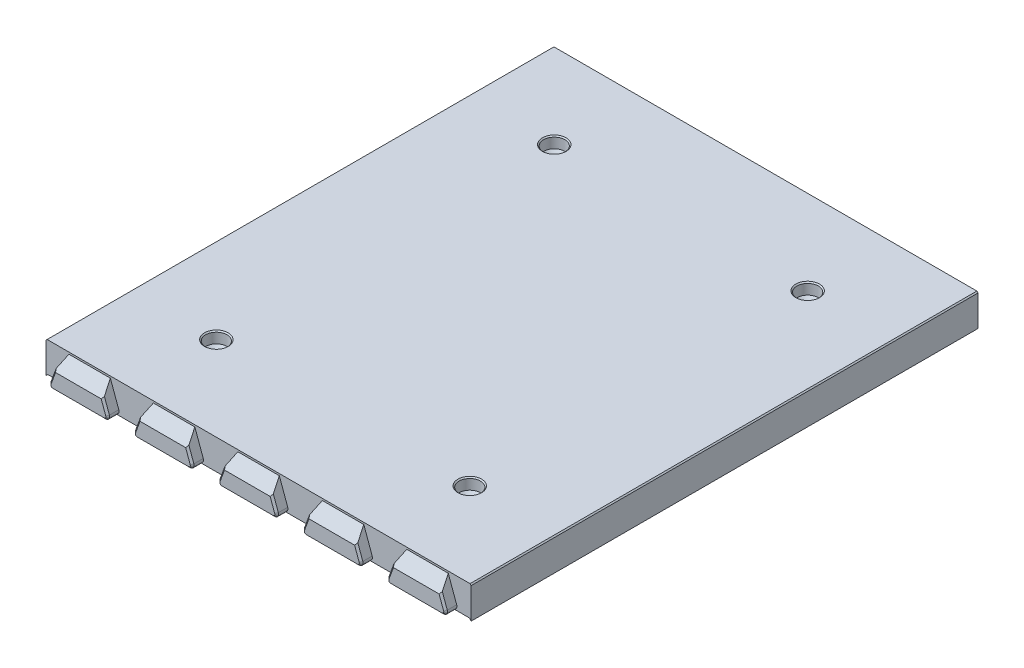
from build123d import *

# Parameters (mm, degrees)
BOSS_EXTRUDE1_DEPTH             = 67.5
SKETCH7_W                       = 109.25
SKETCH7_H                       = 6
BOSS_EXTRUDE7_DEPTH             = 1
BOSS_EXTRUDE4_DEPTH             = 3
BOSS_EXTRUDE8_REACH             = 90.468
BOSS_EXTRUDE8_DIRECTION_2_DEPTH = 2
CHAMFER4_SIZE                   = 0.5
FILLET4_R                       = 1
CHAMFER6_SIZE                   = 0.5
FILLET2_R                       = 2
CHAMFER4_OF_MIRROR2_SIZE        = 0.5
FILLET4_OF_MIRROR2_R            = 1
CHAMFER6_OF_MIRROR2_SIZE        = 0.5
FILLET2_OF_MIRROR2_R            = 2
BOSS_EXTRUDE9_REACH             = 151.38
SKETCH9_R                       = 5
FILLET3_R                       = 3
SKETCH10_R                      = 1.85
CUT_EXTRUDE2_DEPTH              = 150.380020836
SKETCH11_R                      = 2.85
CUT_EXTRUDE3_DEPTH              = 3
CHAMFER7_SIZE                   = 1
CUT_EXTRUDE4_DEPTH              = 150.380020836
CUT_EXTRUDE4_DEPTH_BACK         = 150.380020836
BOSS_EXTRUDE10_DEPTH            = 135
CHAMFER8_SIZE                   = 0.3


with BuildPart() as part:
    # Sketch1 → Boss-Extrude1 (new body)
    with BuildSketch(Plane.XY):
        Polygon((-56.625, 0), (-56.625, 8), (56.625, 8), (56.625, 0), (54.625, 0), (54.625, 6), (-54.625, 6), (-54.625, 0), align=None)
    boss_extrude1 = extrude(amount=-BOSS_EXTRUDE1_DEPTH)

    # Sketch7 → Boss-Extrude7 (add)
    with BuildSketch(Plane.XY):
        with Locations((0, 3)):
            Rectangle(SKETCH7_W, SKETCH7_H)
    boss_extrude7 = extrude(amount=-BOSS_EXTRUDE7_DEPTH)

    # Sketch2 → Boss-Extrude4 (add)
    with BuildSketch(Plane.XY):
        Polygon((39.661761874, 8), (36.75, 0), (53.25, 0), (50.338238126, 8), align=None)
        Polygon((17.161761874, 8), (14.25, 0), (30.75, 0), (27.838238126, 8), align=None)
        Polygon((-5.338238126, 8), (-8.25, 0), (8.25, 0), (5.338238126, 8), align=None)
        Polygon((-27.838238126, 8), (-30.75, 0), (-14.25, 0), (-17.161761874, 8), align=None)
        Polygon((-50.338238126, 8), (-53.25, 0), (-36.75, 0), (-39.661761874, 8), align=None)
    boss_extrude4 = extrude(amount=BOSS_EXTRUDE4_DEPTH)

    # Sketch8 → Boss-Extrude8 (add, up to next)
    with BuildSketch(Plane.XZ, mode=Mode.PRIVATE) as boss_extrude8_sk1:
        Polygon((-55.25, -24.955880937), (-55.25, -20.044119063), (-51.25, -21.5), (-51.25, -23.5), align=None)
    boss_extrude8_tool1 = extrude(boss_extrude8_sk1.sketch, amount=-BOSS_EXTRUDE8_REACH, mode=Mode.PRIVATE) - part.part
    # Sketch8 → Boss-Extrude8 (add, up to next)
    with BuildSketch(Plane.XZ, mode=Mode.PRIVATE) as boss_extrude8_sk2:
        Polygon((-55.25, -67.5), (-55.25, -65.044119063), (-51.25, -66.5), (-51.25, -67.5), align=None)
    boss_extrude8_tool2 = extrude(boss_extrude8_sk2.sketch, amount=-BOSS_EXTRUDE8_REACH, mode=Mode.PRIVATE) - part.part
    # Sketch8 → Boss-Extrude8 (add, up to next)
    with BuildSketch(Plane.XZ, mode=Mode.PRIVATE) as boss_extrude8_sk3:
        Polygon((55.25, -24.955880937), (51.25, -23.5), (51.25, -21.5), (55.25, -20.044119063), align=None)
    boss_extrude8_tool3 = extrude(boss_extrude8_sk3.sketch, amount=-BOSS_EXTRUDE8_REACH, mode=Mode.PRIVATE) - part.part
    # Sketch8 → Boss-Extrude8 (add, up to next)
    with BuildSketch(Plane.XZ, mode=Mode.PRIVATE) as boss_extrude8_sk4:
        Polygon((51.25, -67.5), (55.25, -67.5), (55.25, -65.044119063), (51.25, -66.5), align=None)
    boss_extrude8_tool4 = extrude(boss_extrude8_sk4.sketch, amount=-BOSS_EXTRUDE8_REACH, mode=Mode.PRIVATE) - part.part
    boss_extrude8_1 = boss_extrude8_tool1.solids().sort_by_distance((-53.530851, 0, -22.5))[0]
    add(boss_extrude8_1)
    boss_extrude8_2 = boss_extrude8_tool2.solids().sort_by_distance((-53.530851, 0, -66.584919))[0]
    add(boss_extrude8_2)
    boss_extrude8_3 = boss_extrude8_tool3.solids().sort_by_distance((53.530851, 0, -22.5))[0]
    add(boss_extrude8_3)
    boss_extrude8_4 = boss_extrude8_tool4.solids().sort_by_distance((53.530851, 0, -66.584919))[0]
    add(boss_extrude8_4)
    boss_extrude8 = boss_extrude8_1 + boss_extrude8_2 + boss_extrude8_3 + boss_extrude8_4  # Boss-Extrude8 as one shape, for the pattern or mirror that repeats it

    # Sketch8 → Boss-Extrude8 direction 2 (add)
    with BuildSketch(Plane.XZ):
        Polygon((-55.25, -24.955880937), (-55.25, -20.044119063), (-51.25, -21.5), (-51.25, -23.5), align=None)
        Polygon((-55.25, -67.5), (-55.25, -65.044119063), (-51.25, -66.5), (-51.25, -67.5), align=None)
        Polygon((55.25, -24.955880937), (51.25, -23.5), (51.25, -21.5), (55.25, -20.044119063), align=None)
        Polygon((51.25, -67.5), (55.25, -67.5), (55.25, -65.044119063), (51.25, -66.5), align=None)
    boss_extrude8_direction_2 = extrude(amount=BOSS_EXTRUDE8_DIRECTION_2_DEPTH)

    # Chamfer4
    chamfer4_edges = [part.edges().sort_by_distance(p)[0] for p in [
        (-51.25, -2, -67),
        (-53.25, -2, -65.772059531),
        (-55.25, -2, -66.272059531),
        (-53.25, -2, -20.772059531),
        (-55.25, -2, -22.5),
        (-53.25, -2, -24.227940469),
        (-51.25, -2, -22.5),
        (55.25, -2, -22.5),
        (53.25, -2, -20.772059531),
        (51.25, -2, -22.5),
        (53.25, -2, -24.227940469),
        (51.25, -2, -67),
        (55.25, -2, -66.272059531),
        (53.25, -2, -65.772059531),
    ]]
    chamfer(chamfer4_edges, length=CHAMFER4_SIZE)

    # Fillet4
    fillet4_edges = [part.edges().sort_by_distance(p)[0] for p in [
        (36.75, 0, 1.5),
        (53.25, 0, 1.5),
        (14.25, 0, 1.5),
        (30.75, 0, 1.5),
        (-8.25, 0, 1.5),
        (8.25, 0, 1.5),
        (-53.25, 0, 1.5),
        (-36.75, 0, 1.5),
        (-30.75, 0, 1.5),
        (-14.25, 0, 1.5),
    ]]
    fillet(fillet4_edges, radius=FILLET4_R)

    # Chamfer6
    chamfer6_edges = [part.edges().sort_by_distance(p)[0] for p in [
        (51.54989137, 4.671010072, 3),
        (45, 0, 3),
        (22.5, 0, 3),
        (0, 0, 3),
        (-22.5, 0, 3),
        (-45, 0, 3),
        (37.358995962, 0.426423564, 3),
        (52.641004038, 0.426423564, 3),
        (29.04989137, 4.671010072, 3),
        (14.858995962, 0.426423564, 3),
        (30.141004038, 0.426423564, 3),
        (6.54989137, 4.671010072, 3),
        (-7.641004038, 0.426423564, 3),
        (7.641004038, 0.426423564, 3),
        (-15.95010863, 4.671010072, 3),
        (-30.141004038, 0.426423564, 3),
        (-14.858995962, 0.426423564, 3),
        (-38.45010863, 4.671010072, 3),
        (-52.641004038, 0.426423564, 3),
        (-37.358995962, 0.426423564, 3),
        (38.45010863, 4.671010072, 3),
        (15.95010863, 4.671010072, 3),
        (-6.54989137, 4.671010072, 3),
        (-51.54989137, 4.671010072, 3),
        (-29.04989137, 4.671010072, 3),
    ]]
    chamfer(chamfer6_edges, length=CHAMFER6_SIZE)

    # Fillet2
    fillet2_edges = [part.edges().sort_by_distance(p)[0] for p in [
        (-54.625, 6, -45),
        (-54.625, 3, -65.271600459),
        (-51.25, 6, -67),
        (-52.9375, 6, -65.88580023),
        (-54.625, 6, -10.63580023),
        (-54.625, 3, -20.271600459),
        (-54.625, 3, -24.728399541),
        (-52.9375, 6, -20.88580023),
        (-51.25, 6, -22.5),
        (-52.9375, 6, -24.11419977),
        (54.625, 6, -10.63580023),
        (54.625, 3, -20.271600459),
        (54.625, 3, -24.728399541),
        (52.9375, 6, -20.88580023),
        (52.9375, 6, -24.11419977),
        (51.25, 6, -22.5),
        (54.625, 6, -45),
        (54.625, 3, -65.271600459),
        (51.25, 6, -67),
        (52.9375, 6, -65.88580023),
        (-54.625, 3, -1),
        (0, 6, -1),
        (54.625, 3, -1),
    ]]
    fillet(fillet2_edges, radius=FILLET2_R)


with BuildPart() as mirror2_1:
    # Mirror2: Boss-Extrude1, Boss-Extrude7, Boss-Extrude4, Boss-Extrude8, Boss-Extrude8 direction 2 across plane
    add(boss_extrude1.mirror(Plane.XY.offset(-67.5)))
    add(boss_extrude7.mirror(Plane.XY.offset(-67.5)))
    add(boss_extrude4.mirror(Plane.XY.offset(-67.5)))
    add(boss_extrude8.mirror(Plane.XY.offset(-67.5)))
    add(boss_extrude8_direction_2.mirror(Plane.XY.offset(-67.5)))

    # Chamfer4 of Mirror2
    chamfer4_of_mirror2_edges = [mirror2_1.edges().sort_by_distance(p)[0] for p in [
        (-51.25, -2, -68),
        (-53.25, -2, -69.227940469),
        (-55.25, -2, -68.727940469),
        (-53.25, -2, -114.227940469),
        (-55.25, -2, -112.5),
        (-53.25, -2, -110.772059531),
        (-51.25, -2, -112.5),
        (55.25, -2, -112.5),
        (53.25, -2, -114.227940469),
        (51.25, -2, -112.5),
        (53.25, -2, -110.772059531),
        (51.25, -2, -68),
        (55.25, -2, -68.727940469),
        (53.25, -2, -69.227940469),
    ]]
    chamfer(chamfer4_of_mirror2_edges, length=CHAMFER4_OF_MIRROR2_SIZE)

    # Fillet4 of Mirror2
    fillet4_of_mirror2_edges = [mirror2_1.edges().sort_by_distance(p)[0] for p in [
        (36.75, 0, -136.5),
        (53.25, 0, -136.5),
        (14.25, 0, -136.5),
        (30.75, 0, -136.5),
        (-8.25, 0, -136.5),
        (8.25, 0, -136.5),
        (-53.25, 0, -136.5),
        (-36.75, 0, -136.5),
        (-30.75, 0, -136.5),
        (-14.25, 0, -136.5),
    ]]
    fillet(fillet4_of_mirror2_edges, radius=FILLET4_OF_MIRROR2_R)

    # Chamfer6 of Mirror2
    chamfer6_of_mirror2_edges = [mirror2_1.edges().sort_by_distance(p)[0] for p in [
        (51.54989137, 4.671010072, -138),
        (45, 0, -138),
        (22.5, 0, -138),
        (0, 0, -138),
        (-22.5, 0, -138),
        (-45, 0, -138),
        (37.358995962, 0.426423564, -138),
        (52.641004038, 0.426423564, -138),
        (29.04989137, 4.671010072, -138),
        (14.858995962, 0.426423564, -138),
        (30.141004038, 0.426423564, -138),
        (6.54989137, 4.671010072, -138),
        (-7.641004038, 0.426423564, -138),
        (7.641004038, 0.426423564, -138),
        (-15.95010863, 4.671010072, -138),
        (-30.141004038, 0.426423564, -138),
        (-14.858995962, 0.426423564, -138),
        (-38.45010863, 4.671010072, -138),
        (-52.641004038, 0.426423564, -138),
        (-37.358995962, 0.426423564, -138),
        (38.45010863, 4.671010072, -138),
        (15.95010863, 4.671010072, -138),
        (-6.54989137, 4.671010072, -138),
        (-51.54989137, 4.671010072, -138),
        (-29.04989137, 4.671010072, -138),
    ]]
    chamfer(chamfer6_of_mirror2_edges, length=CHAMFER6_OF_MIRROR2_SIZE)

    # Fillet2 of Mirror2
    fillet2_of_mirror2_edges = [mirror2_1.edges().sort_by_distance(p)[0] for p in [
        (-54.625, 6, -90),
        (-54.625, 3, -69.728399541),
        (-51.25, 6, -68),
        (-52.9375, 6, -69.11419977),
        (-54.625, 6, -124.36419977),
        (-54.625, 3, -114.728399541),
        (-54.625, 3, -110.271600459),
        (-52.9375, 6, -114.11419977),
        (-51.25, 6, -112.5),
        (-52.9375, 6, -110.88580023),
        (54.625, 6, -124.36419977),
        (54.625, 3, -114.728399541),
        (54.625, 3, -110.271600459),
        (52.9375, 6, -114.11419977),
        (52.9375, 6, -110.88580023),
        (51.25, 6, -112.5),
        (54.625, 6, -90),
        (54.625, 3, -69.728399541),
        (51.25, 6, -68),
        (52.9375, 6, -69.11419977),
        (-54.625, 3, -134),
        (0, 6, -134),
        (54.625, 3, -134),
    ]]
    fillet(fillet2_of_mirror2_edges, radius=FILLET2_OF_MIRROR2_R)


with BuildPart() as part_1:
    add(part.part)

    # Mirror2 united with what the copies touc: union Mirror2_1
    add(mirror2_1.part)

    # Sketch9 → Boss-Extrude9 (add, up to next)
    with BuildSketch(Plane(origin=(0, 0, 0), x_dir=(1, 0, 0), z_dir=(0, 1, 0)), mode=Mode.PRIVATE) as boss_extrude9_sk1:
        with Locations(Location((-33.75, 22.5, 0), (0, 0, 90))):
            Circle(SKETCH9_R)
    boss_extrude9_tool1 = extrude(boss_extrude9_sk1.sketch, amount=BOSS_EXTRUDE9_REACH, mode=Mode.PRIVATE) - part_1.part
    # Sketch9 → Boss-Extrude9 (add, up to next)
    with BuildSketch(Plane(origin=(0, 0, 0), x_dir=(1, 0, 0), z_dir=(0, 1, 0)), mode=Mode.PRIVATE) as boss_extrude9_sk2:
        with Locations(Location((33.75, 22.5, 0), (0, 0, 90))):
            Circle(SKETCH9_R)
    boss_extrude9_tool2 = extrude(boss_extrude9_sk2.sketch, amount=BOSS_EXTRUDE9_REACH, mode=Mode.PRIVATE) - part_1.part
    # Sketch9 → Boss-Extrude9 (add, up to next)
    with BuildSketch(Plane(origin=(0, 0, 0), x_dir=(1, 0, 0), z_dir=(0, 1, 0)), mode=Mode.PRIVATE) as boss_extrude9_sk3:
        with Locations(Location((33.75, 112.5, 0), (0, 0, 90))):
            Circle(SKETCH9_R)
    boss_extrude9_tool3 = extrude(boss_extrude9_sk3.sketch, amount=BOSS_EXTRUDE9_REACH, mode=Mode.PRIVATE) - part_1.part
    # Sketch9 → Boss-Extrude9 (add, up to next)
    with BuildSketch(Plane(origin=(0, 0, 0), x_dir=(1, 0, 0), z_dir=(0, 1, 0)), mode=Mode.PRIVATE) as boss_extrude9_sk4:
        with Locations(Location((-33.75, 112.5, 0), (0, 0, 90))):
            Circle(SKETCH9_R)
    boss_extrude9_tool4 = extrude(boss_extrude9_sk4.sketch, amount=BOSS_EXTRUDE9_REACH, mode=Mode.PRIVATE) - part_1.part
    add(boss_extrude9_tool1.solids().sort_by_distance((-33.75, 0, -22.5))[0])
    add(boss_extrude9_tool2.solids().sort_by_distance((33.75, 0, -22.5))[0])
    add(boss_extrude9_tool3.solids().sort_by_distance((33.75, 0, -112.5))[0])
    add(boss_extrude9_tool4.solids().sort_by_distance((-33.75, 0, -112.5))[0])

    # Fillet3
    fillet3_edges = [part_1.edges().sort_by_distance(p)[0] for p in [
        (33.75, 6, -17.5),
        (-33.75, 6, -17.5),
        (-33.75, 6, -107.5),
        (33.75, 6, -107.5),
    ]]
    fillet(fillet3_edges, radius=FILLET3_R)

    # Sketch10 → Cut-Extrude2 (cut, through all)
    with BuildSketch(Plane(origin=(0, 0, 0), x_dir=(1, 0, 0), z_dir=(0, 1, 0))):
        with Locations(Location((-33.75, 112.5, 0), (0, 0, 270))):
            Circle(SKETCH10_R)
        with Locations(Location((-33.75, 22.5, 0), (0, 0, 270))):
            Circle(SKETCH10_R)
        with Locations(Location((33.75, 22.5, 0), (0, 0, 270))):
            Circle(SKETCH10_R)
        with Locations(Location((33.75, 112.5, 0), (0, 0, 270))):
            Circle(SKETCH10_R)
    extrude(amount=CUT_EXTRUDE2_DEPTH, mode=Mode.SUBTRACT)

    # Sketch11 → Cut-Extrude3 (cut)
    with BuildSketch(Plane(origin=(0, 8, 0), x_dir=(1, 0, 0), z_dir=(0, 1, 0))):
        with Locations(Location((-33.75, 112.5, 0), (0, 0, 270))):
            Circle(SKETCH11_R)
        with Locations(Location((33.75, 112.5, 0), (0, 0, 270))):
            Circle(SKETCH11_R)
        with Locations(Location((33.75, 22.5, 0), (0, 0, 270))):
            Circle(SKETCH11_R)
        with Locations(Location((-33.75, 22.5, 0), (0, 0, 270))):
            Circle(SKETCH11_R)
    extrude(amount=-CUT_EXTRUDE3_DEPTH, mode=Mode.SUBTRACT)

    # Chamfer7
    chamfer7_edges = [part_1.edges().sort_by_distance(p)[0] for p in [
        (-33.75, 5, -24.35),
        (33.75, 5, -24.35),
        (33.75, 5, -114.35),
        (-33.75, 5, -114.35),
    ]]
    chamfer(chamfer7_edges, length=CHAMFER7_SIZE - 0.0001)  # a hair under: the kernel refuses the full size

    # Sketch12 → Cut-Extrude4 (cut, two sides: drawn at the far end of the back side and taken through both)
    with BuildSketch(Plane(origin=(0, 0, 0), x_dir=(0, 0, -1), z_dir=(1, 0, 0)).offset(-CUT_EXTRUDE4_DEPTH_BACK)):
        Polygon((0, 7.5), (-3, 4.5), (-3, 7.5), (-3, 8), (0, 8), align=None)
        Polygon((138, 4.5), (138, 7.5), (138, 8), (135, 8), (135, 7.5), align=None)
    extrude(amount=CUT_EXTRUDE4_DEPTH + CUT_EXTRUDE4_DEPTH_BACK, mode=Mode.SUBTRACT)

    # Sketch13 → Boss-Extrude10 (add)
    with BuildSketch(Plane(origin=(0, 0, -135), x_dir=(-1, 0, 0), z_dir=(0, 0, -1))):
        Polygon((-56.125, 0), (-56.625, -0.5), (-56.625, 0), align=None)
        Polygon((56.625, 0), (56.125, 0), (56.625, -0.5), align=None)
    extrude(amount=-BOSS_EXTRUDE10_DEPTH)

    # Chamfer8
    chamfer8_edges = [part_1.edges().sort_by_distance(p)[0] for p in [
        (-56.625, 8, -67.5),
        (56.625, 8, -67.5),
        (-33.75, 8, -25.35),
        (33.75, 8, -25.35),
        (33.75, 8, -115.35),
        (-33.75, 8, -115.35),
    ]]
    chamfer(chamfer8_edges, length=CHAMFER8_SIZE)


solid = part_1.part
